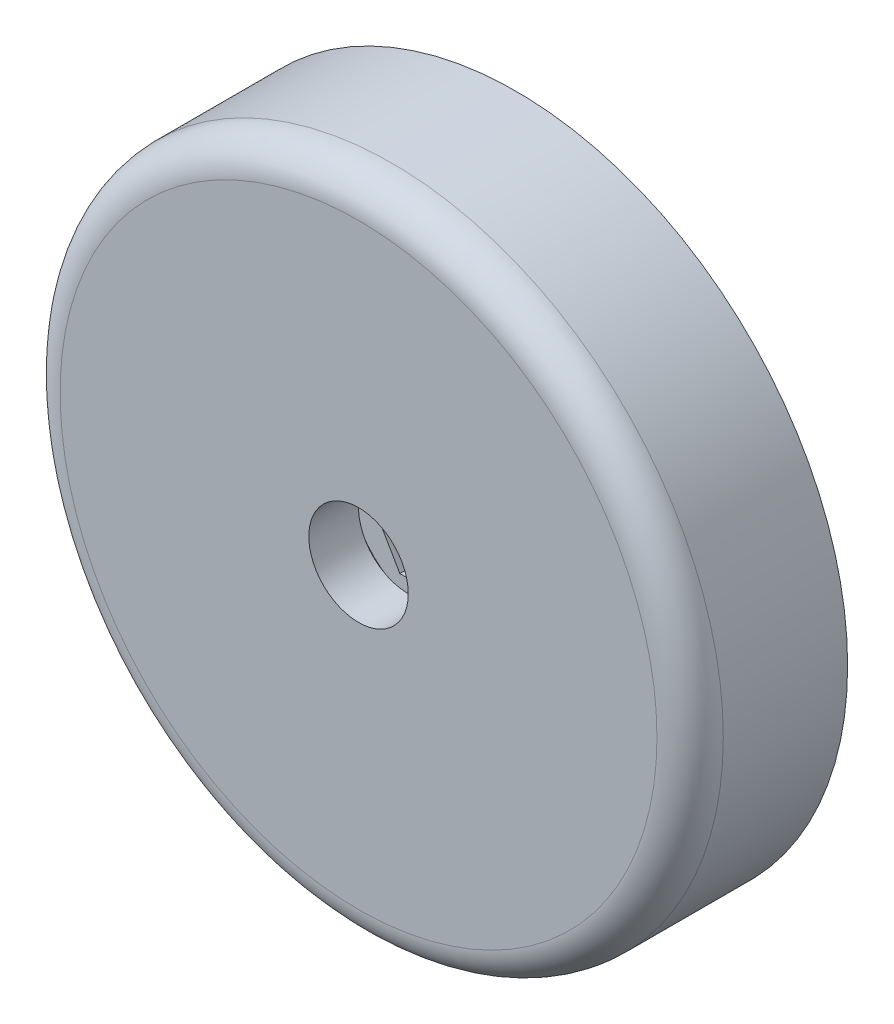
from build123d import *

# Parameters (mm, degrees)
SKETCH1_R                       = 20
SKETCH1_R_2                     = 1
BOSS_EXTRUDE1_DEPTH             = 22.5
TAP_DRILL_FOR_M5X0_8_TAP1_D     = 4.2
TAP_DRILL_FOR_M5X0_8_TAP1_DEPTH = 5
TAP_DRILL_FOR_M5X0_8_TAP1_TIP   = 1.2618073
SKETCH4_W                       = 2.794
SKETCH4_H                       = 6.604
CUT_EXTRUDE1_DEPTH              = 20.5
CIRPATTERN1_COUNT               = 5
CUT_EXTRUDE3_START              = -6
SKETCH6_W                       = 4.62
SKETCH6_H                       = 8
SKETCH6_R                       = 2.1
CUT_EXTRUDE3_DEPTH              = 6
SKETCH7_R                       = 5.5
CUT_EXTRUDE4_DEPTH              = 1.8
SKETCH9_R                       = 3.014010562
CUT_EXTRUDE5_DEPTH              = 2
CHAMFER1_SIZE                   = 2
SKETCH8_R                       = 20
SKETCH8_R_2                     = 3
BOSS_EXTRUDE2_DEPTH             = 3
SKETCH5_R                       = 6
SKETCH5_R_2                     = 5
CUT_EXTRUDE2_DEPTH              = 1
FILLET3_R                       = 0.5
FILLET4_R                       = 2
SKETCH10_W                      = 43.83789535
SKETCH10_H                      = 47.8950696
CUT_EXTRUDE6_DEPTH              = 16


with BuildPart() as part:
    # Sketch1 → Boss-Extrude1 (new body)
    with BuildSketch(Plane.XY):
        with Locations(Location((-11.822558412, 14.529752947, 0), (0, 0, 180))):
            Circle(SKETCH1_R)
        with Locations(Location((-11.822558412, 14.529752947, 0), (0, 0, 180))):
            Circle(SKETCH1_R_2, mode=Mode.SUBTRACT)
    extrude(amount=BOSS_EXTRUDE1_DEPTH)

    # Tap Drill for M5x0.8 Tap1
    with Locations(Plane.XY.offset(22.5)):
        with Locations((-11.822558412, 14.529752947)):
            Hole(TAP_DRILL_FOR_M5X0_8_TAP1_D / 2, depth=TAP_DRILL_FOR_M5X0_8_TAP1_DEPTH)
            with Locations((0, 0, -(TAP_DRILL_FOR_M5X0_8_TAP1_DEPTH + TAP_DRILL_FOR_M5X0_8_TAP1_TIP / 2))):  # 118° drill point
                Cone(0, TAP_DRILL_FOR_M5X0_8_TAP1_D / 2, TAP_DRILL_FOR_M5X0_8_TAP1_TIP, mode=Mode.SUBTRACT)

    # Sketch4 → Cut-Extrude1 (cut)
    with BuildSketch(Plane.XY.offset(22.5)):
        with Locations((4.780441588, 14.531752947)):
            Rectangle(SKETCH4_W, SKETCH4_H)
    cut_extrude1 = extrude(amount=-CUT_EXTRUDE1_DEPTH, mode=Mode.SUBTRACT)

    # CirPattern1: Cut-Extrude1 ×5 about axis
    cirpattern1_axis = Axis((-11.822558412, 14.529752947, 0), (0, 0, 1))
    for i in range(1, CIRPATTERN1_COUNT):
        add(cut_extrude1.rotate(cirpattern1_axis, i * 360 / CIRPATTERN1_COUNT), mode=Mode.SUBTRACT)

    # Sketch6 → Cut-Extrude3 (cut)
    # profile 1 of 4: a face of its own
    with BuildSketch(Plane.XY.offset(22.5).offset(CUT_EXTRUDE3_START)):
        Polygon((-16.444354251, 14.529752947), (-14.132558412, 18.529752947), (-14.132558412, 10.529752947), align=None)
    # profile 2 of 4: a face of its own
    with BuildSketch(Plane.XY.offset(22.5).offset(CUT_EXTRUDE3_START)):
        Polygon((-7.200762573, 14.529752947), (-9.512558412, 10.529752947), (-9.512558412, 18.529752947), align=None)
    # profile 3 of 4: a face of its own
    with BuildSketch(Plane.XY.offset(22.5).offset(CUT_EXTRUDE3_START)):
        with Locations((-11.822558412, 14.529752947)):
            Rectangle(SKETCH6_W, SKETCH6_H)
        with Locations((-11.822558412, 14.529752947)):
            Circle(SKETCH6_R, mode=Mode.SUBTRACT)
    # profile 4 of 4: a face of its own
    with BuildSketch(Plane.XY.offset(22.5).offset(CUT_EXTRUDE3_START)):
        with Locations((-11.822558412, 14.529752947)):
            Circle(SKETCH6_R)
    extrude(amount=CUT_EXTRUDE3_DEPTH, mode=Mode.SUBTRACT)

    # Sketch7 → Cut-Extrude4 (cut)
    with BuildSketch(Plane.XY.offset(22.5)):
        with Locations((-11.822558412, 14.529752947)):
            Circle(SKETCH7_R)
    extrude(amount=-CUT_EXTRUDE4_DEPTH, mode=Mode.SUBTRACT)

    # Sketch9 → Cut-Extrude5 (cut)
    with BuildSketch(Plane.XY.offset(16.5)):
        with Locations((-11.822558412, 14.529752947)):
            Circle(SKETCH9_R)
    extrude(amount=-CUT_EXTRUDE5_DEPTH, mode=Mode.SUBTRACT)

    # Chamfer1
    chamfer1_edges = [part.edges().sort_by_distance(p)[0] for p in [
        (-14.836568974, 14.529752947, 14.5),
    ]]
    chamfer(chamfer1_edges, length=CHAMFER1_SIZE - 0.0001)  # a hair under: the kernel refuses the full size

    # Sketch8 → Boss-Extrude2 (add)
    with BuildSketch(Plane.XY.offset(22.5)):
        with Locations(Location((-11.822558412, 14.529752947, 0), (0, 0, 180))):
            Circle(SKETCH8_R)
        with Locations((-11.822558412, 14.529752947)):
            Circle(SKETCH8_R_2, mode=Mode.SUBTRACT)
    extrude(amount=BOSS_EXTRUDE2_DEPTH)

    # Sketch5 → Cut-Extrude2 (cut)
    with BuildSketch(Plane(origin=(0, 0, 0), x_dir=(-1, 0, 0), z_dir=(0, 0, -1))):
        with Locations((11.822558412, 14.529752947)):
            Circle(SKETCH5_R)
        with Locations((11.822558412, 14.529752947)):
            Circle(SKETCH5_R_2, mode=Mode.SUBTRACT)
    extrude(amount=-CUT_EXTRUDE2_DEPTH, mode=Mode.SUBTRACT)

    # Fillet3
    fillet3_edges = [part.edges().sort_by_distance(p)[0] for p in [
        (-5.822558412, 14.529752947, 1),
        (-6.822558412, 14.529752947, 1),
    ]]
    fillet(fillet3_edges, radius=FILLET3_R - 0.0001)  # a hair under: the kernel refuses the full size

    # Fillet4
    fillet4_edges = [part.edges().sort_by_distance(p)[0] for p in [
        (8.177441588, 14.529752947, 25.5),
    ]]
    fillet(fillet4_edges, radius=FILLET4_R)

    # Sketch10 → Cut-Extrude6 (cut)
    with BuildSketch(Plane(origin=(0, 0, 0), x_dir=(-1, 0, 0), z_dir=(0, 0, -1))):
        with Locations((12.103243423, 14.057691792)):
            Rectangle(SKETCH10_W, SKETCH10_H)
    extrude(amount=-CUT_EXTRUDE6_DEPTH, mode=Mode.SUBTRACT)


solid = part.part
